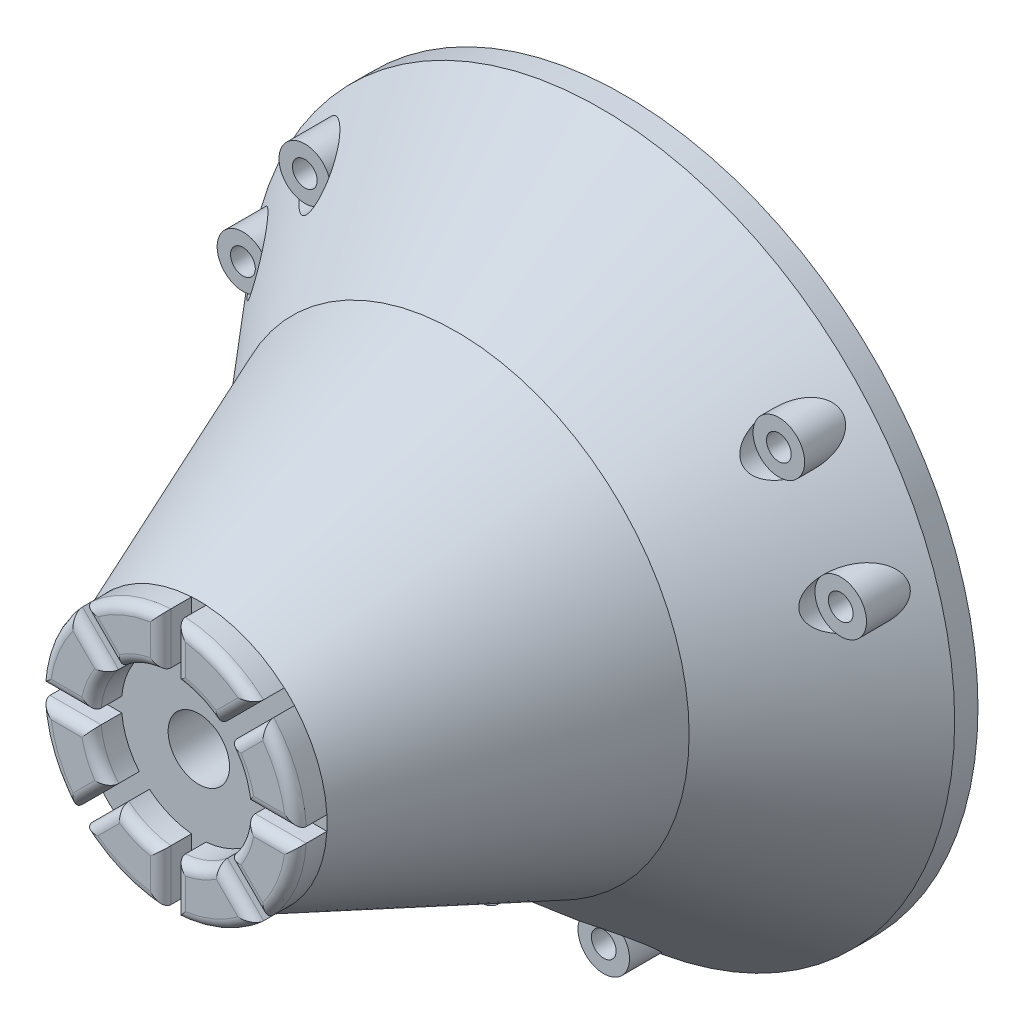
from build123d import *

# Parameters (mm, degrees)
SKETCH1_R          = 34.29
SKETCH1_R_2        = 26.9875
EXTRUDE1_DEPTH     = 1.76
SKETCH6_R          = 34.29
SKETCH6_R_2        = 25.5
EXTRUDE5_DEPTH     = 6
SKETCH19_R         = 34.29
EXTRUDE17_DEPTH    = 8.5
SKETCH20_R         = 25.5
CUT_EXTRUDE1_DEPTH = 6.5
CUT_EXTRUDE1_DRAFT = -37
CHAMFER1_SIZE      = 14
CHAMFER1_SIZE2     = 11.747394836
SKETCH21_R         = 2.5
EXTRUDE18_DEPTH    = 8
SKETCH22_R         = 2.5
CUT_EXTRUDE3_DEPTH = 8
SKETCH23_R         = 1.2
CUT_EXTRUDE4_DEPTH = 50.191826713
SKETCH24_R         = 22.542605164
EXTRUDE19_DEPTH    = 25
EXTRUDE19_TAPER    = 22
SKETCH25_R         = 2.975
CUT_EXTRUDE5_DEPTH = 6.5
EXTRUDE20_DEPTH    = 3
FILLET1_R          = 1


# Read off the part's stored shape, not the designer's step: Shell1
with BuildPart() as part:
    # Sketch1 → Extrude1 (new body)
    with BuildSketch(Plane.XY):
        Circle(SKETCH1_R)
        Circle(SKETCH1_R_2, mode=Mode.SUBTRACT)
    extrude(amount=EXTRUDE1_DEPTH)

    # Sketch6 → Extrude5 (add)
    with BuildSketch(Plane.XY.offset(1.76)):
        Circle(SKETCH6_R)
        Circle(SKETCH6_R_2, mode=Mode.SUBTRACT)
    extrude(amount=EXTRUDE5_DEPTH)

    # Sketch19 → Extrude17 (add)
    with BuildSketch(Plane.XY.offset(7.76)):
        Circle(SKETCH19_R)
    extrude(amount=EXTRUDE17_DEPTH)


with BuildPart() as cut_extrude1_tool:
    # Sketch20 → Cut-Extrude1 (with draft: the straight prism first)
    with BuildSketch(Plane(origin=(0, 0, 7.76), x_dir=(-1, 0, 0), z_dir=(0, 0, -1))):
        Circle(SKETCH20_R)
    extrude(amount=-CUT_EXTRUDE1_DEPTH)
    # Cut-Extrude1: the draft: its side faces are tilted about the plane it starts from
    cut_extrude1_sides = [cut_extrude1_tool.faces().sort_by_distance(p)[0] for p in [
        (25.5, 0, 11.01),
    ]]
    draft(cut_extrude1_sides, Plane(origin=(0, 0, 7.76), x_dir=(-1, 0, 0), z_dir=(0, 0, -1)), CUT_EXTRUDE1_DRAFT)


with BuildPart() as part_1:
    add(part.part)

    # Cut-Extrude1: cut by cut_extrude1_tool
    add(cut_extrude1_tool.part, mode=Mode.SUBTRACT)

    # Chamfer1
    chamfer1_edges = [part_1.edges().sort_by_distance(p)[0] for p in [
        (-34.29, 0, 16.26),
    ]]
    chamfer1_side = [part_1.faces().sort_by_distance(p)[0] for p in [
        (-34.29, 0, 8.13),
    ]]
    chamfer(chamfer1_edges, length=CHAMFER1_SIZE, length2=CHAMFER1_SIZE2, reference=chamfer1_side[0])

    # Sketch21 → Extrude18 (add)
    with BuildSketch(Plane(origin=(0, 0, 0), x_dir=(-1, 0, 0), z_dir=(0, 0, -1))):
        with Locations((-6, -30)):
            Circle(SKETCH21_R)
        with Locations((6, -30)):
            Circle(SKETCH21_R)
        with Locations((-22.980762114, 20.196152423)):
            Circle(SKETCH21_R)
        with Locations((-28.980762114, 9.803847577)):
            Circle(SKETCH21_R)
        with Locations((28.980762114, 9.803847577)):
            Circle(SKETCH21_R)
        with Locations((22.980762114, 20.196152423)):
            Circle(SKETCH21_R)
    extrude(amount=-EXTRUDE18_DEPTH)

    # Sketch22 → Cut-Extrude3 (cut)
    with BuildSketch(Plane.XY.offset(8)):
        with Locations((-6, -30)):
            Circle(SKETCH22_R)
        with Locations((6, -30)):
            Circle(SKETCH22_R)
        with Locations((28.980762114, 9.803847577)):
            Circle(SKETCH22_R)
        with Locations((22.980762114, 20.196152423)):
            Circle(SKETCH22_R)
        with Locations((-22.980762114, 20.196152423)):
            Circle(SKETCH22_R)
        with Locations((-28.980762114, 9.803847577)):
            Circle(SKETCH22_R)
    extrude(amount=CUT_EXTRUDE3_DEPTH, mode=Mode.SUBTRACT)

    # Sketch23 → Cut-Extrude4 (cut, through all)
    with BuildSketch(Plane.XY.offset(8)):
        with Locations((-22.980762114, 20.196152423)):
            Circle(SKETCH23_R)
        with Locations((-28.980762114, 9.803847577)):
            Circle(SKETCH23_R)
        with Locations((28.980762114, 9.803847577)):
            Circle(SKETCH23_R)
        with Locations((22.980762114, 20.196152423)):
            Circle(SKETCH23_R)
        with Locations((-6, -30)):
            Circle(SKETCH23_R)
        with Locations((6, -30)):
            Circle(SKETCH23_R)
    extrude(amount=-CUT_EXTRUDE4_DEPTH, mode=Mode.SUBTRACT)

    # Sketch24 → Extrude19 (add)
    with BuildSketch(Plane.XY.offset(16.26)):
        Circle(SKETCH24_R)
    extrude(amount=EXTRUDE19_DEPTH, taper=EXTRUDE19_TAPER)

    # Sketch25 → Cut-Extrude5 (cut)
    with BuildSketch(Plane.XY.offset(41.26)):
        Circle(SKETCH25_R)
    extrude(amount=-CUT_EXTRUDE5_DEPTH, mode=Mode.SUBTRACT)

    # Shell1 outline → Shell1 (revolve, cut)
    with BuildSketch(Plane.XZ):
        Polygon((20.565664016, 14.26), (20.112619567, 14.79991735), (10.55332567, 38.46), (5.775, 38.46), (5.775, 31.96), (0, 31.96), (0, 14.26), align=None)
    revolve(axis=Axis((0, 0, 0), (0, 0, 1)), mode=Mode.SUBTRACT)

    # Sketch26 → Extrude20 (add)
    with BuildSketch(Plane.XY.offset(41.26)):
        with BuildLine():
            Line((0.7, 12.422242463), (0.7, 7.467261881))
            ThreePointArc((0.7, 7.467261881), (2.870125743, 6.929096494), (4.785176766, 5.77512626))
            Line((4.785176766, 5.77512626), (8.288877136, 9.27882663))
            ThreePointArc((8.288877136, 9.27882663), (4.761327947, 11.494862504), (0.7, 12.422242463))
        make_face()
        with BuildLine():
            Line((9.27882663, 8.288877136), (5.77512626, 4.785176766))
            ThreePointArc((5.77512626, 4.785176766), (6.929096494, 2.870125743), (7.467261881, 0.7))
            Line((7.467261881, 0.7), (12.422242463, 0.7))
            ThreePointArc((12.422242463, 0.7), (11.494862504, 4.761327947), (9.27882663, 8.288877136))
        make_face()
        with BuildLine():
            Line((12.422242463, -0.7), (7.467261881, -0.7))
            ThreePointArc((7.467261881, -0.7), (6.929096494, -2.870125743), (5.77512626, -4.785176766))
            Line((5.77512626, -4.785176766), (9.27882663, -8.288877136))
            ThreePointArc((9.27882663, -8.288877136), (11.494862504, -4.761327947), (12.422242463, -0.7))
        make_face()
        with BuildLine():
            Line((8.288877136, -9.27882663), (4.785176766, -5.77512626))
            ThreePointArc((4.785176766, -5.77512626), (2.870125743, -6.929096494), (0.7, -7.467261881))
            Line((0.7, -7.467261881), (0.7, -12.422242463))
            ThreePointArc((0.7, -12.422242463), (4.761327947, -11.494862504), (8.288877136, -9.27882663))
        make_face()
        with BuildLine():
            Line((-0.7, -12.422242463), (-0.7, -7.467261881))
            ThreePointArc((-0.7, -7.467261881), (-2.870125743, -6.929096494), (-4.785176766, -5.77512626))
            Line((-4.785176766, -5.77512626), (-8.288877136, -9.27882663))
            ThreePointArc((-8.288877136, -9.27882663), (-4.761327947, -11.494862504), (-0.7, -12.422242463))
        make_face()
        with BuildLine():
            Line((-9.27882663, -8.288877136), (-5.77512626, -4.785176766))
            ThreePointArc((-5.77512626, -4.785176766), (-6.929096494, -2.870125743), (-7.467261881, -0.7))
            Line((-7.467261881, -0.7), (-12.422242463, -0.7))
            ThreePointArc((-12.422242463, -0.7), (-11.494862504, -4.761327947), (-9.27882663, -8.288877136))
        make_face()
        with BuildLine():
            Line((-12.422242463, 0.7), (-7.467261881, 0.7))
            ThreePointArc((-7.467261881, 0.7), (-6.929096494, 2.870125743), (-5.77512626, 4.785176766))
            Line((-5.77512626, 4.785176766), (-9.27882663, 8.288877136))
            ThreePointArc((-9.27882663, 8.288877136), (-11.494862504, 4.761327947), (-12.422242463, 0.7))
        make_face()
        with BuildLine():
            Line((-8.288877136, 9.27882663), (-4.785176766, 5.77512626))
            ThreePointArc((-4.785176766, 5.77512626), (-2.870125743, 6.929096494), (-0.7, 7.467261881))
            Line((-0.7, 7.467261881), (-0.7, 12.422242463))
            ThreePointArc((-0.7, 12.422242463), (-4.761327947, 11.494862504), (-8.288877136, 9.27882663))
        make_face()
    extrude(amount=EXTRUDE20_DEPTH)

    # Fillet1
    fillet1_edges = [part_1.edges().sort_by_distance(p)[0] for p in [
        (-7.526976445, 6.537026951, 44.26),
        (-6.929096494, 2.870125743, 44.26),
        (-9.944752172, 0.7, 44.26),
        (-11.494862504, 4.761327947, 44.26),
        (-9.944752172, -0.7, 44.26),
        (-6.929096494, -2.870125743, 44.26),
        (-7.526976445, -6.537026951, 44.26),
        (-11.494862504, -4.761327947, 44.26),
        (-6.537026951, -7.526976445, 44.26),
        (-2.870125743, -6.929096494, 44.26),
        (-0.7, -9.944752172, 44.26),
        (-4.761327947, -11.494862504, 44.26),
        (0.7, -9.944752172, 44.26),
        (2.870125743, -6.929096494, 44.26),
        (6.537026951, -7.526976445, 44.26),
        (4.761327947, -11.494862504, 44.26),
        (7.526976445, -6.537026951, 44.26),
        (6.929096494, -2.870125743, 44.26),
        (9.944752172, -0.7, 44.26),
        (11.494862504, -4.761327947, 44.26),
        (9.944752172, 0.7, 44.26),
        (6.929096494, 2.870125743, 44.26),
        (7.526976445, 6.537026951, 44.26),
        (11.494862504, 4.761327947, 44.26),
        (6.537026951, 7.526976445, 44.26),
        (2.870125743, 6.929096494, 44.26),
        (0.7, 9.944752172, 44.26),
        (4.761327947, 11.494862504, 44.26),
        (-0.7, 9.944752172, 44.26),
        (-2.870125743, 6.929096494, 44.26),
        (-6.537026951, 7.526976445, 44.26),
        (-4.761327947, 11.494862504, 44.26),
    ]]
    fillet(fillet1_edges, radius=FILLET1_R)


solid = part_1.part
